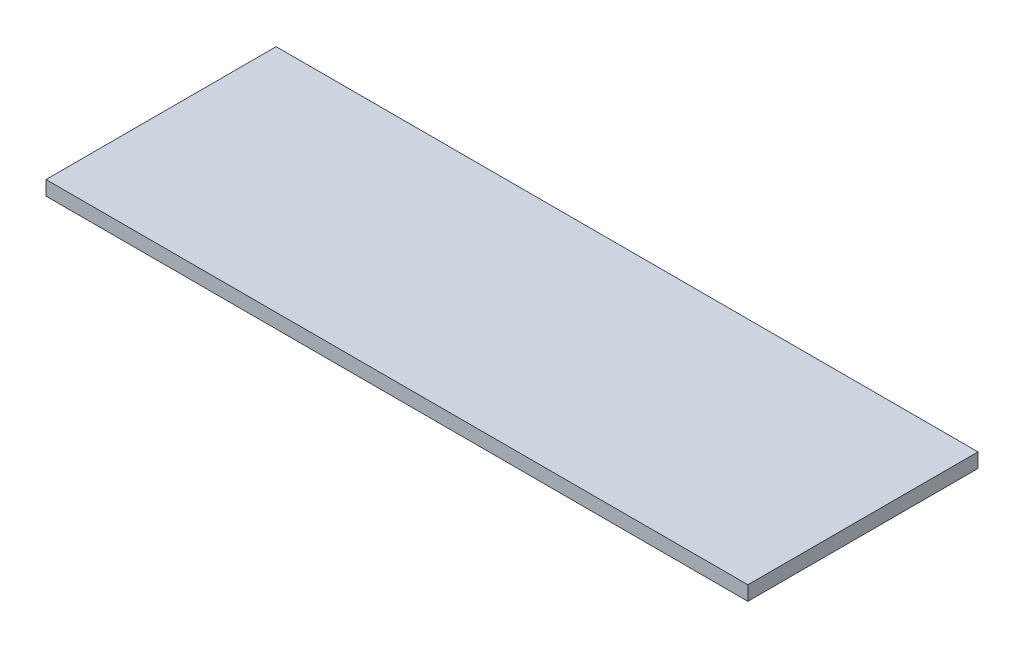
from build123d import *

# Parameters (mm, degrees)
SKETCH_1_W      = 244
SKETCH_1_H      = 80
EXTRUDE_1_DEPTH = 5


with BuildPart() as part:
    # 草图1 → 凸台-拉伸1 (new body)
    with BuildSketch(Plane(origin=(0, 0, 0), x_dir=(1, 0, 0), z_dir=(0, 1, 0))):
        with Locations((122, -40)):
            Rectangle(SKETCH_1_W, SKETCH_1_H)
    extrude(amount=EXTRUDE_1_DEPTH)


solid = part.part
